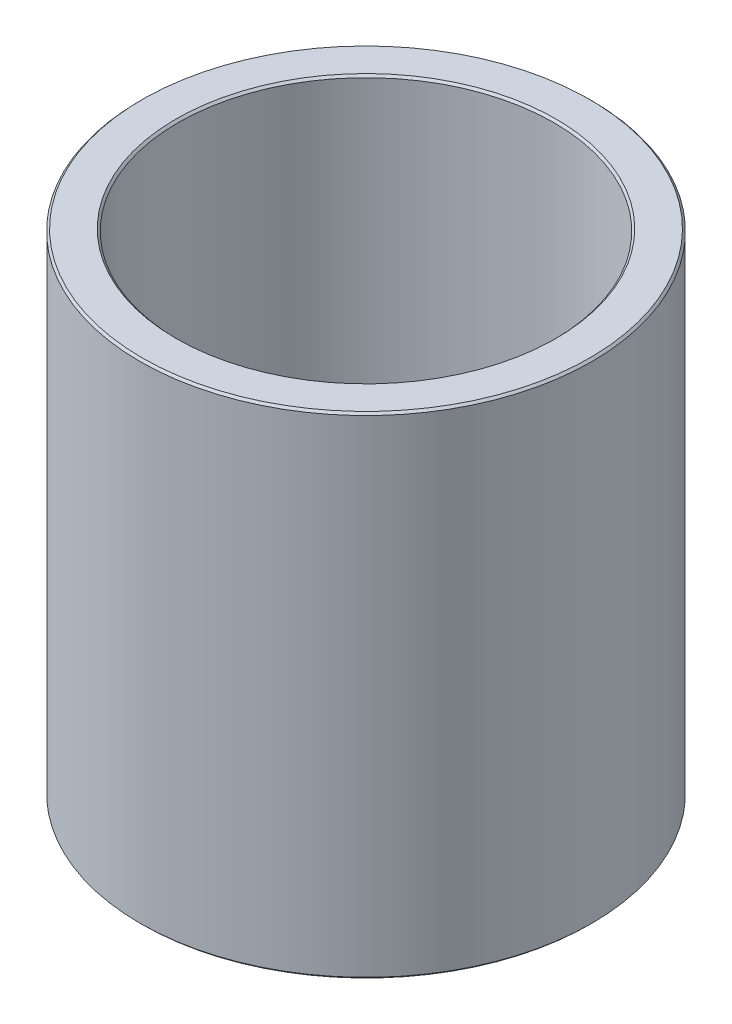
from build123d import *

# Parameters (mm, degrees)
SKETCH1_R           = 45
BOSS_EXTRUDE1_DEPTH = 97.754344076
SKETCH2_R           = 37.440523809
CUT_EXTRUDE1_DEPTH  = 117.644381715
CHAMFER1_SIZE       = 0.418461382


with BuildPart() as part:
    # Sketch1 → Boss-Extrude1 (new body)
    with BuildSketch(Plane(origin=(0, 0, 0), x_dir=(1, 0, 0), z_dir=(0, 1, 0))):
        Circle(SKETCH1_R)
    extrude(amount=BOSS_EXTRUDE1_DEPTH)

    # Sketch2 → Cut-Extrude1 (cut, through all)
    with BuildSketch(Plane(origin=(0, 0, 0), x_dir=(1, 0, 0), z_dir=(0, 1, 0))):
        Circle(SKETCH2_R)
    extrude(amount=CUT_EXTRUDE1_DEPTH, mode=Mode.SUBTRACT)

    # Chamfer1
    chamfer1_edges = [part.edges().sort_by_distance(p)[0] for p in [
        (-37.440523809, 97.754344076, 0),
        (-37.440523809, 0, 0),
        (-45, 0, 0),
        (-45, 97.754344076, 0),
    ]]
    chamfer(chamfer1_edges, length=CHAMFER1_SIZE)


solid = part.part
